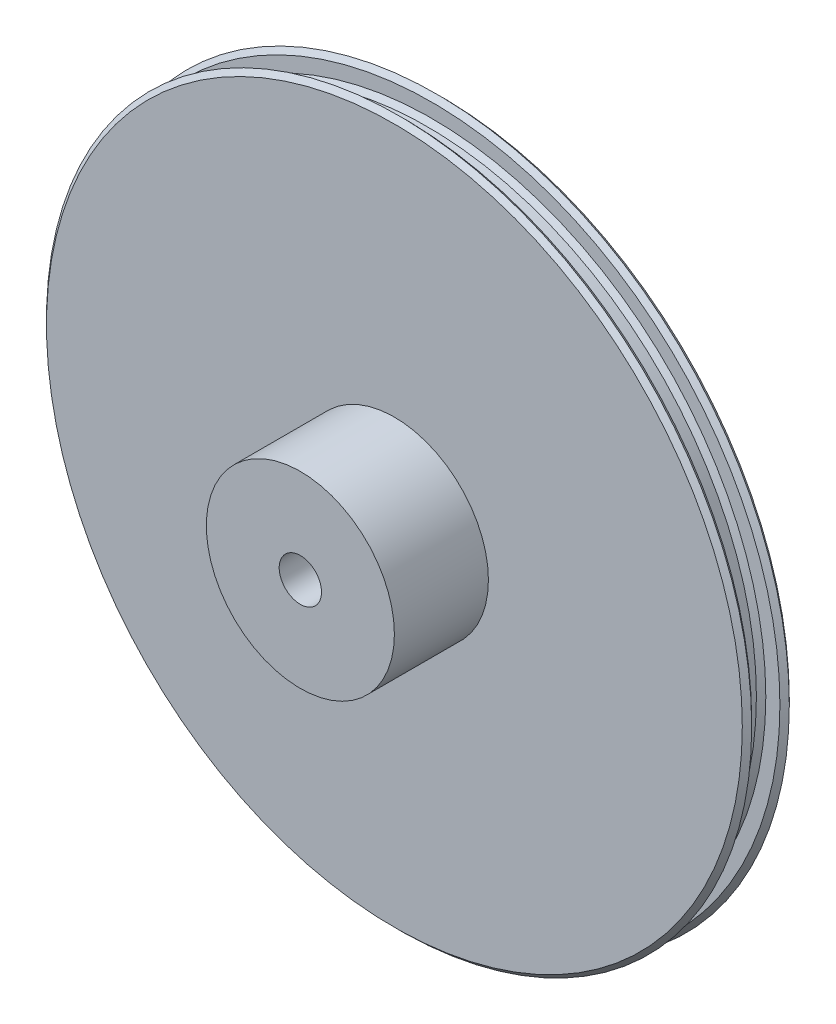
from build123d import *

# Parameters (mm, degrees)
SKETCH1_R           = 75
BOSS_EXTRUDE1_DEPTH = 2
SKETCH2_R           = 70
BOSS_EXTRUDE2_DEPTH = 6
SKETCH3_R           = 75
BOSS_EXTRUDE3_DEPTH = 2
CHAMFER1_SIZE       = 1
CHAMFER2_SIZE       = 1
SKETCH4_R           = 20
BOSS_EXTRUDE5_DEPTH = 20
SKETCH5_R           = 4.5
CUT_EXTRUDE1_DEPTH  = 111.227038425
CUT_EXTRUDE2_START  = -5
SKETCH6_W           = 3
SKETCH6_H           = 6
CUT_EXTRUDE2_DEPTH  = 20


with BuildPart() as part:
    # Sketch1 → Boss-Extrude1 (new body)
    with BuildSketch(Plane.XY):
        Circle(SKETCH1_R)
    extrude(amount=BOSS_EXTRUDE1_DEPTH)

    # Sketch2 → Boss-Extrude2 (add)
    with BuildSketch(Plane.XY.offset(2)):
        Circle(SKETCH2_R)
    extrude(amount=BOSS_EXTRUDE2_DEPTH)

    # Sketch3 → Boss-Extrude3 (add)
    with BuildSketch(Plane.XY.offset(8)):
        Circle(SKETCH3_R)
    extrude(amount=BOSS_EXTRUDE3_DEPTH)

    # Chamfer1
    chamfer1_edges = [part.edges().sort_by_distance(p)[0] for p in [
        (-75, 0, 0),
        (-75, 0, 2),
        (-70, 0, 2),
    ]]
    chamfer(chamfer1_edges, length=CHAMFER1_SIZE - 0.0001)  # a hair under: the kernel refuses the full size

    # Chamfer2
    chamfer2_edges = [part.edges().sort_by_distance(p)[0] for p in [
        (-75, 0, 8),
        (-75, 0, 10),
        (-70, 0, 8),
    ]]
    chamfer(chamfer2_edges, length=CHAMFER2_SIZE - 0.0001)  # a hair under: the kernel refuses the full size

    # Sketch4 → Boss-Extrude5 (add)
    with BuildSketch(Plane.XY.offset(10)):
        Circle(SKETCH4_R)
    extrude(amount=BOSS_EXTRUDE5_DEPTH)

    # Sketch5 → Cut-Extrude1 (cut, through all)
    with BuildSketch(Plane.XY.offset(30)):
        Circle(SKETCH5_R)
    extrude(amount=-CUT_EXTRUDE1_DEPTH, mode=Mode.SUBTRACT)

    # Sketch6 → Cut-Extrude2 (cut)
    with BuildSketch(Plane.XY.offset(30).offset(CUT_EXTRUDE2_START)):
        with Locations((0, 4.5)):
            Rectangle(SKETCH6_W, SKETCH6_H)
    extrude(amount=-CUT_EXTRUDE2_DEPTH, mode=Mode.SUBTRACT)


solid = part.part
